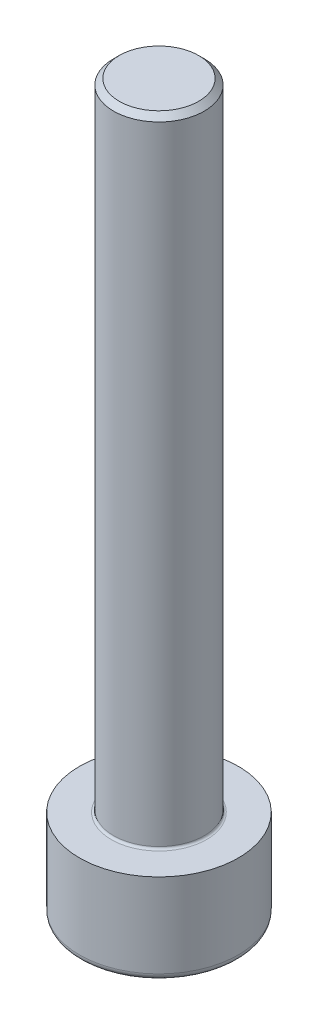
from build123d import *

# Parameters (mm, degrees)
CUT_EXTRUDE_1_REACH = 34.381


with BuildPart() as part:
    # 草图1 → 旋转1 (revolve)
    with BuildSketch(Plane.XY):
        with BuildLine():
            Line((0, 3.366025404), (0, 32))
            Line((0, 32), (1.75, 32))
            Line((1.75, 32), (2, 31.75))
            Line((2, 31.75), (2, 4.1))
            ThreePointArc((2, 4.1), (2.029289322, 4.029289322), (2.1, 4))
            Line((2.1, 4), (3.5, 4))
            Line((3.5, 4), (3.5, 0.3))
            ThreePointArc((3.5, 0.3), (3.412132034, 0.087867966), (3.2, 0))
            Line((3.2, 0), (1.5, 0))
            Line((1.5, 0), (1.5, 2.5))
            Line((1.5, 2.5), (0, 3.366025404))
        make_face()
    revolve(axis=Axis((0, 3.366025404, 0), (0, -1, 0)))

    # 切除-拉伸1: up to this cone (the profile starts inside it)
    cut_extrude_1_end = Plane(origin=(0, 0, 0), z_dir=(0, -1, 0)).offset(-3.366024404) * Cone(1.732e-06, 76.343867449, 44.077151423, align=(Align.CENTER, Align.CENTER, Align.MIN), mode=Mode.PRIVATE)
    # 草图2 → 切除-拉伸1 (cut, up to the surface)
    with BuildSketch(Plane.XZ, mode=Mode.PRIVATE) as cut_extrude_1_sk1:
        Polygon((1.5, -0.866025404), (1.5, 0.866025404), (0, 1.732050808), (-1.5, 0.866025404), (-1.5, -0.866025404), (0, -1.732050808), align=None)
    cut_extrude_1_tool1 = extrude(cut_extrude_1_sk1.sketch, amount=-CUT_EXTRUDE_1_REACH, mode=Mode.PRIVATE) & cut_extrude_1_end
    add(cut_extrude_1_tool1.solids().sort_by_distance((0, 0, 0))[0], mode=Mode.SUBTRACT)


solid = part.part
